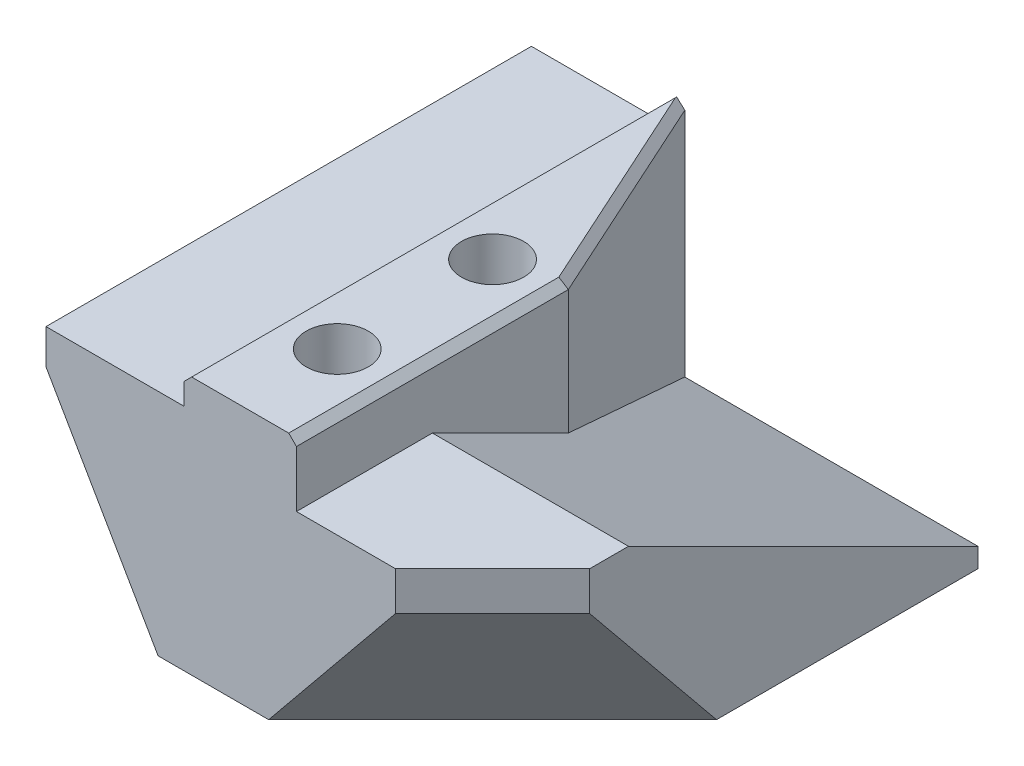
from build123d import *

# Parameters (mm, degrees)
SKETCH_1_W           = 20
SKETCH_1_H           = 20
EXTRUDE_1_DEPTH      = 4
SKETCH_2_W           = 12.9
SKETCH_2_H           = 20
EXTRUDE_2_DEPTH      = 3.8
SKETCH_3_R           = 1.6
CUT_EXTRUDE_1_DEPTH  = 30.340074983
SKETCH_4_W           = 5.8
SKETCH_4_H           = 20
SKETCH_4_R           = 1.6
EXTRUDE_3_DEPTH      = 1.5
SKETCH_5_R           = 3
CUT_EXTRUDE_3_DEPTH  = 2.4
SKETCH_6_W           = 20
SKETCH_6_H           = 4
EXTRUDE_4_DEPTH      = 3
EXTRUDE_START        = 4
SKETCH_7_W           = 23
SKETCH_7_H           = 20
SKETCH_7_R           = 3
EXTRUDE_5_DEPTH      = 4
SKETCH_9_W           = 10.1
SKETCH_9_H           = 20
EXTRUDE_6_DEPTH      = 2
EXTRUDE_7_DEPTH      = 5
CHAMFER_7_SIZE       = 10
CHAMFER_7_SIZE2      = 5.773502692
CHAMFER_8_SIZE       = 5
CHAMFER_9_SIZE       = 8
CHAMFER_9_SIZE2      = 4.618802154
CUT_EXTRUDE_9_DEPTH  = 10.1
CUT_EXTRUDE_10_REACH = 38.481
CHAMFER_10_SIZE      = 1.5
CHAMFER_11_SIZE      = 0.4


with BuildPart() as part:
    # 草图1 → 凸台-拉伸1 (new body)
    with BuildSketch(Plane(origin=(0, 0, 0), x_dir=(1, 0, 0), z_dir=(0, 1, 0))):
        with Locations((10, 10)):
            Rectangle(SKETCH_1_W, SKETCH_1_H)
    extrude(amount=EXTRUDE_1_DEPTH)

    # 草图2 → 凸台-拉伸2 (add)
    with BuildSketch(Plane(origin=(0, 4, 0), x_dir=(1, 0, 0), z_dir=(0, 1, 0))):
        with Locations((6.45, 10)):
            Rectangle(SKETCH_2_W, SKETCH_2_H)
    extrude(amount=EXTRUDE_2_DEPTH)

    # 草图3 → 切除-拉伸1 (cut, through all)
    with BuildSketch(Plane(origin=(0, 0, 0), x_dir=(-1, 0, 0), z_dir=(0, -1, 0))):
        with Locations(Location((-10, 5, 0), (0, 0, 90))):
            Circle(SKETCH_3_R)
        with Locations(Location((-10, 13, 0), (0, 0, 90))):
            Circle(SKETCH_3_R)
    extrude(amount=-CUT_EXTRUDE_1_DEPTH, mode=Mode.SUBTRACT)

    # 草图4 → 凸台-拉伸3 (add)
    with BuildSketch(Plane(origin=(0, 7.8, 0), x_dir=(1, 0, 0), z_dir=(0, 1, 0))):
        with Locations((10, 10)):
            Rectangle(SKETCH_4_W, SKETCH_4_H)
        with Locations(Location((10, 13, 0), (0, 0, 90))):
            Circle(SKETCH_4_R, mode=Mode.SUBTRACT)
        with Locations(Location((10, 5, 0), (0, 0, 90))):
            Circle(SKETCH_4_R, mode=Mode.SUBTRACT)
    extrude(amount=EXTRUDE_3_DEPTH)

    # 草图5 → 切除-拉伸3 (cut)
    with BuildSketch(Plane(origin=(0, 0, 0), x_dir=(-1, 0, 0), z_dir=(0, -1, 0))):
        with Locations(Location((-10, 5, 0), (0, 0, 90))):
            Circle(SKETCH_5_R)
        with Locations(Location((-10, 13, 0), (0, 0, 90))):
            Circle(SKETCH_5_R)
    extrude(amount=-CUT_EXTRUDE_3_DEPTH, mode=Mode.SUBTRACT)

    # 草图6 → 凸台-拉伸4 (add)
    with BuildSketch(Plane(origin=(20, 0, 0), x_dir=(0, 0, -1), z_dir=(1, 0, 0))):
        with Locations((10, 2)):
            Rectangle(SKETCH_6_W, SKETCH_6_H)
    extrude(amount=EXTRUDE_4_DEPTH)

    # 草图7 → 凸台-拉伸5 (add)
    with BuildSketch(Plane(origin=(0, 0, 0), x_dir=(-1, 0, 0), z_dir=(0, -1, 0)).offset(EXTRUDE_START)):
        with Locations((-11.5, 10)):
            Rectangle(SKETCH_7_W, SKETCH_7_H)
        with Locations(Location((-10, 13, 0), (0, 0, 90))):
            Circle(SKETCH_7_R, mode=Mode.SUBTRACT)
        with Locations(Location((-10, 5, 0), (0, 0, 90))):
            Circle(SKETCH_7_R, mode=Mode.SUBTRACT)
    extrude(amount=-EXTRUDE_5_DEPTH)

    # 草图9 → 凸台-拉伸6 (add)
    with BuildSketch(Plane(origin=(0, 4, 0), x_dir=(1, 0, 0), z_dir=(0, 1, 0))):
        with Locations((17.95, 10)):
            Rectangle(SKETCH_9_W, SKETCH_9_H)
    extrude(amount=EXTRUDE_6_DEPTH)

    # 草图11 → 凸台-拉伸7 (add)
    with BuildSketch(Plane(origin=(0, 0, -20), x_dir=(-1, 0, 0), z_dir=(0, 0, -1))):
        Polygon((-23, 6), (-23, -4), (0, -4), (0, 7.8), (-7.1, 7.8), (-7.1, 9.3), (-12.9, 9.3), (-12.9, 6), align=None)
    extrude(amount=EXTRUDE_7_DEPTH)

    # 倒角7
    chamfer_7_edges = [part.edges().sort_by_distance(p)[0] for p in [
        (0, -4, -12.5),
    ]]
    chamfer_7_side = [part.faces().sort_by_distance(p)[0] for p in [
        (0, 1.9, -12.5),
    ]]
    chamfer(chamfer_7_edges, length=CHAMFER_7_SIZE, length2=CHAMFER_7_SIZE2, reference=chamfer_7_side[0])

    # 倒角8
    chamfer_8_edges = [part.edges().sort_by_distance(p)[0] for p in [
        (23, 1, 0),
    ]]
    chamfer(chamfer_8_edges, length=CHAMFER_8_SIZE)

    # 倒角9
    chamfer_9_edges = [part.edges().sort_by_distance(p)[0] for p in [
        (20.5, -4, -2.5),
    ]]
    chamfer_9_side = [part.faces().sort_by_distance(p)[0] for p in [
        (20.5, 1, -2.5),
    ]]
    chamfer(chamfer_9_edges, length=CHAMFER_9_SIZE, length2=CHAMFER_9_SIZE2, reference=chamfer_9_side[0])

    # 草图15 → 切除-拉伸9 (cut)
    with BuildSketch(Plane(origin=(23, 0, 0), x_dir=(0, 0, -1), z_dir=(1, 0, 0))):
        Polygon((25, -3), (25, 6), (7, 6), align=None)
    extrude(amount=-CUT_EXTRUDE_9_DEPTH, mode=Mode.SUBTRACT)

    # 切除-拉伸10: up to this plane
    cut_extrude_10_end = Plane(origin=(-7.224611797, 6, -7), z_dir=(0, -0.894427190999916, 0.447213595499958))
    # 草图16 → 切除-拉伸10 (cut, up to the surface)
    with BuildSketch(Plane(origin=(0, 9.3, 0), x_dir=(1, 0, 0), z_dir=(0, 1, 0)), mode=Mode.PRIVATE) as cut_extrude_10_sk1:
        Polygon((7.9, 25), (12.9, 25), (12.9, 14), align=None)
    cut_extrude_10_tool1 = split(extrude(cut_extrude_10_sk1.sketch, amount=-CUT_EXTRUDE_10_REACH, mode=Mode.PRIVATE), bisect_by=cut_extrude_10_end, keep=Keep.BOTH, mode=Mode.PRIVATE)
    add(cut_extrude_10_tool1.solids().sort_by_distance((11.233333, 9.3, -21.333333))[0], mode=Mode.SUBTRACT)

    # 倒角10
    # the kernel refuses this chamfer: 1.5 mm, written as the material it takes off along each edge
    with BuildSketch(Plane(origin=(10, 2.4, -13), x_dir=(0, 0, -1), z_dir=(-1, 0, 0))) as chamfer_10_piece_1_section:
        Polygon((1.6, -CHAMFER_10_SIZE), (1.6 + CHAMFER_10_SIZE, 0), (1.6, 0), align=None)
    chamfer_10_piece_1 = revolve(axis=Axis((10, 2.4, -13), (0, -1, 0)), mode=Mode.PRIVATE)
    chamfer_10_piece_1 = chamfer_10_piece_1 & Plane(origin=(10, 2.4, -13), x_dir=(0, 0, -1), z_dir=(0, -1, 0)) * Cylinder(3, 13, mode=Mode.PRIVATE)
    add(chamfer_10_piece_1, mode=Mode.SUBTRACT)
    with BuildSketch(Plane(origin=(10, 2.4, -5), x_dir=(0, 0, -1), z_dir=(-1, 0, 0))) as chamfer_10_piece_2_section:
        Polygon((1.6, -CHAMFER_10_SIZE), (1.6 + CHAMFER_10_SIZE, 0), (1.6, 0), align=None)
    chamfer_10_piece_2 = revolve(axis=Axis((10, 2.4, -5), (0, -1, 0)), mode=Mode.PRIVATE)
    chamfer_10_piece_2 = chamfer_10_piece_2 & Plane(origin=(10, 2.4, -5), x_dir=(0, 0, -1), z_dir=(0, -1, 0)) * Cylinder(3, 13, mode=Mode.PRIVATE)
    add(chamfer_10_piece_2, mode=Mode.SUBTRACT)

    # 倒角11
    # the kernel refuses this chamfer: 0.4 mm, written as the material it takes off along each edge
    with BuildSketch(Plane(origin=(13.325667997, 9.3, -13.063530407), x_dir=(-0.9103664774626047, 4.440892098500618e-15, 0.41380294430118414), z_dir=(-0.4138029443011842, 0, -0.9103664774626047))) as chamfer_11_piece_1:
        Polygon((CHAMFER_11_SIZE, 0), (0, -CHAMFER_11_SIZE), (0, 0), align=None)
    extrude(amount=14.140392364, mode=Mode.SUBTRACT)
    with BuildSketch(Plane(origin=(12.9, 9.3, 1.028673195), x_dir=(-1, 0, 0), z_dir=(0, 0, -1))) as chamfer_11_piece_2:
        Polygon((CHAMFER_11_SIZE, 0), (0, -CHAMFER_11_SIZE), (0, 0), align=None)
    extrude(amount=16.05734639, mode=Mode.SUBTRACT)
    with BuildSketch(Plane(origin=(7.1, 9.3, 1.028673195), x_dir=(1, 0, 0), z_dir=(0, 0, -1))) as chamfer_11_piece_3:
        Polygon((CHAMFER_11_SIZE, 0), (0, CHAMFER_11_SIZE), (0, 0), align=None)
    extrude(amount=27.05734639, mode=Mode.SUBTRACT)


solid = part.part
